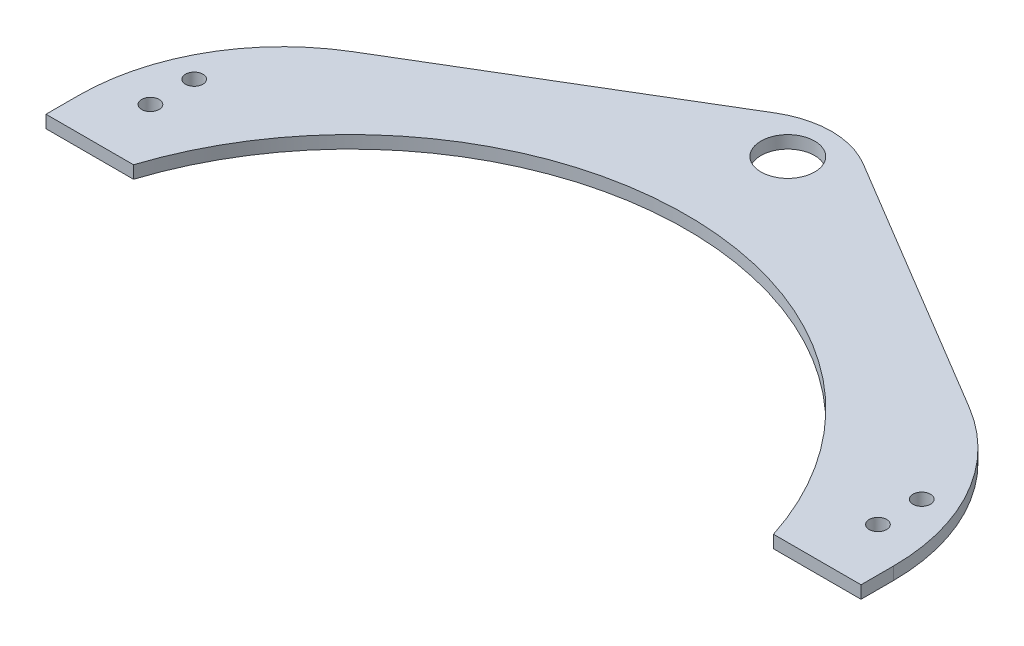
from build123d import *

# Parameters (mm, degrees)
SKETCH1_R           = 4.6
SKETCH1_R_2         = 1.5
BOSS_EXTRUDE2_DEPTH = 3.175
SKETCH2_W           = 235.965281387
SKETCH2_H           = 118.721671229
CUT_EXTRUDE1_DEPTH  = 1.016


with BuildPart() as part:
    # Sketch1 → Boss-Extrude2 (new body)
    with BuildSketch(Plane(origin=(0, 0, 0), x_dir=(1, 0, 0), z_dir=(0, 1, 0))):
        with BuildLine():
            Line((109.700000056, 0), (117.200000056, 0))
            Line((117.200000056, 0), (124.700000056, 0))
            Line((124.700000056, 0), (124.700000056, 5.554920326))
            ThreePointArc((124.700000056, 5.554920326), (120.146392707, 22.818094267), (107.670447225, 35.589284453))
            Line((107.670447225, 35.589284453), (62.40678526, 62.67187034))
            ThreePointArc((62.40678526, 62.67187034), (58.77003956, 64.238725538), (54.850000028, 64.799300745))
            ThreePointArc((54.850000028, 64.799300745), (50.929960496, 64.238725538), (47.293214796, 62.67187034))
            Line((47.293214796, 62.67187034), (2.029552831, 35.589284453))
            ThreePointArc((2.029552831, 35.589284453), (-10.446392651, 22.818094267), (-15, 5.554920326))
            Line((-15, 5.554920326), (-15, 0))
            Line((-15, 0), (-7.5, 0))
            Line((-7.5, 0), (0, 0))
            ThreePointArc((0, 0), (54.850000028, 39.949878845), (109.700000056, 0))
        make_face()
        with Locations((54.850000028, 57.3)):
            Circle(SKETCH1_R, mode=Mode.SUBTRACT)
        with BuildLine():
            ThreePointArc((117.200000056, 8.9), (115.700000056, 10.4), (117.200000056, 11.9))
            ThreePointArc((117.200000056, 11.9), (118.700000056, 10.4), (117.200000056, 8.9))
        make_face(mode=Mode.SUBTRACT)
        with Locations((117.200000056, 17.9)):
            Circle(SKETCH1_R_2, mode=Mode.SUBTRACT)
        with BuildLine():
            ThreePointArc((-7.5, 8.9), (-9, 10.4), (-7.5, 11.9))
            ThreePointArc((-7.5, 11.9), (-6, 10.4), (-7.5, 8.9))
        make_face(mode=Mode.SUBTRACT)
        with Locations((-7.5, 17.9)):
            Circle(SKETCH1_R_2, mode=Mode.SUBTRACT)
    extrude(amount=BOSS_EXTRUDE2_DEPTH)

    # Sketch2 → Cut-Extrude1 (cut)
    with BuildSketch(Plane(origin=(0, 3.175, 0), x_dir=(1, 0, 0), z_dir=(0, 1, 0))):
        with Locations((50.311488443, 30.817995662)):
            Rectangle(SKETCH2_W, SKETCH2_H)
    extrude(amount=-CUT_EXTRUDE1_DEPTH, mode=Mode.SUBTRACT)


solid = part.part
